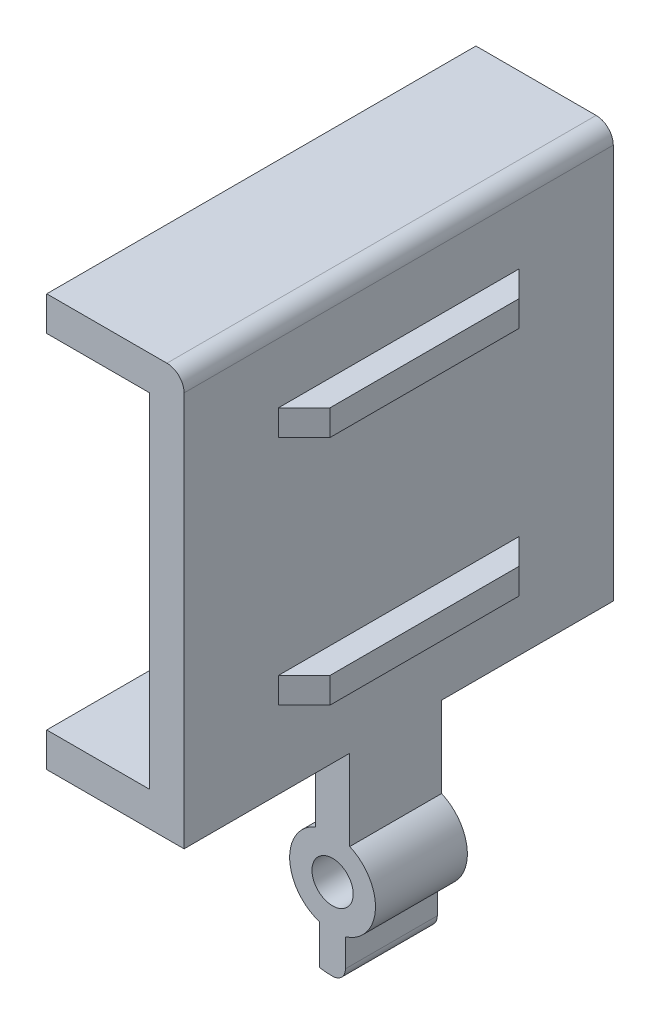
from build123d import *
from build123d.topology import SkipClean

# Parameters (mm, degrees)
LEVER_R                       = 1
BOSS_EXTRUDE1_DEPTH           = 5.35
SKETCH1_R                     = 1.2
CUT_EXTRUDE1_DEPTH            = 32.557448
UPPERJAW_DEPTH                = 5.35
SKETCH5_W                     = 6
SKETCH5_H                     = 2
LOWERJAW_DEPTH                = 5.35
BANDCAPTURE_DEPTH             = 5
BANDCAPTURE_DEPTH_BACK        = 10
SKETCH6_W                     = 1.5
SKETCH6_H                     = 15
CUT_EXTRUDE3_DEPTH            = 34.316662
CUT_EXTRUDE3_DEPTH_BACK       = 34.316662
SKETCH7_W                     = 1.5
SKETCH7_H                     = 12
BATTERYCRADLEWIDTH_DEPTH      = 10
BATTERYCRADLEWIDTH_DEPTH_BACK = 15
CHAMFER1_SIZE                 = 2


with BuildPart() as part:
    # lever → Boss-Extrude1 (new body)
    with BuildSketch(Plane.XY):
        with BuildLine():
            Line((-0.75, -4.690416), (-0.75, -2.384848))
            ThreePointArc((-0.75, -2.384848), (-2.496435, -0.133467), (-1, 2.291288))
            Line((-1, 2.291288), (-1, 30))
            ThreePointArc((-1, 30), (0, 31), (1, 30))
            Line((1, 30), (1, 2.291288))
            ThreePointArc((1, 2.291288), (2.496435, -0.133467), (0.75, -2.384848))
            Line((0.75, -2.384848), (0.75, -4))
            ThreePointArc((0.75, -4), (0.53033, -4.53033), (0, -4.75))
            ThreePointArc((0, -4.75), (-0.376182, -4.735081), (-0.75, -4.690416))
        make_face()
        Circle(LEVER_R, mode=Mode.SUBTRACT)
    extrude(amount=BOSS_EXTRUDE1_DEPTH)

    # Sketch1 → Cut-Extrude1 (cut, through all)
    with BuildSketch(Plane.XY.offset(5.35)):
        Circle(SKETCH1_R)
    extrude(amount=-CUT_EXTRUDE1_DEPTH, mode=Mode.SUBTRACT)

    # Sketch4 → UpperJaw (add)
    with BuildSketch(Plane(origin=(0, 0, 0), x_dir=(-1, 0, 0), z_dir=(0, 0, -1))):
        with BuildLine():
            Line((0, 31), (7, 31))
            Line((7, 31), (7, 29))
            Line((7, 29), (1, 29))
            Line((1, 29), (1, 30))
            ThreePointArc((1, 30), (0.707107, 30.707107), (0, 31))
        make_face()
    extrude(amount=-UPPERJAW_DEPTH)

    # Sketch5 → LowerJaw (add, through all)
    with BuildSketch(Plane(origin=(0, 0, 0), x_dir=(-1, 0, 0), z_dir=(0, 0, -1))):
        with Locations((4, 8)):
            Rectangle(SKETCH5_W, SKETCH5_H)
    extrude(amount=-LOWERJAW_DEPTH)

    # Sketch6 → BandCapture (add, two sides: drawn at the far end of the back side and taken through both)
    with BuildSketch(Plane(origin=(0, 0, 0), x_dir=(-1, 0, 0), z_dir=(0, 0, -1)).offset(-BANDCAPTURE_DEPTH_BACK)):
        with Locations((-1.75, 19)):
            Rectangle(SKETCH6_W, SKETCH6_H)
    extrude(amount=BANDCAPTURE_DEPTH + BANDCAPTURE_DEPTH_BACK)

    # Sketch7 → Cut-Extrude3 (cut, two sides: drawn at the far end of the back side and taken through both)
    with BuildSketch(Plane(origin=(0, 0, 0), x_dir=(-1, 0, 0), z_dir=(0, 0, -1)).offset(-CUT_EXTRUDE3_DEPTH_BACK)):
        with Locations((-1.75, 19)):
            Rectangle(SKETCH7_W, SKETCH7_H)
    extrude(amount=CUT_EXTRUDE3_DEPTH + CUT_EXTRUDE3_DEPTH_BACK, mode=Mode.SUBTRACT)

    # Sketch8 → BatteryCradleWidth (add, two sides: drawn at the far end of the back side and taken through both)
    with SkipClean():  # the faces are left unmerged after this step: merging them gives an invalid solid
        with BuildSketch(Plane(origin=(0, 0, 0), x_dir=(-1, 0, 0), z_dir=(0, 0, -1)).offset(-BATTERYCRADLEWIDTH_DEPTH_BACK)):
            with BuildLine():
                Line((-1, 7), (7, 7))
                Line((7, 7), (7, 9))
                Line((7, 9), (1, 9))
                Line((1, 9), (1, 29))
                Line((1, 29), (7, 29))
                Line((7, 29), (7, 31))
                Line((7, 31), (0, 31))
                ThreePointArc((0, 31), (-0.707107, 30.707107), (-1, 30))
                Line((-1, 30), (-1, 7))
            make_face()
        extrude(amount=BATTERYCRADLEWIDTH_DEPTH + BATTERYCRADLEWIDTH_DEPTH_BACK)

    # Chamfer1
    # the kernel refuses this chamfer: 2 mm, written as the material it takes off along each edge
    with BuildSketch(Plane(origin=(2.5, 19.856634, 10), x_dir=(-0.9996219169112968, 0, 0.027495876610586487), z_dir=(0, 1, 0))) as chamfer1_piece_1_section:
        Polygon((CHAMFER1_SIZE * 0.999621916911, -CHAMFER1_SIZE * 0.0274958766106), (-CHAMFER1_SIZE * 0.0274958766106, -CHAMFER1_SIZE * 0.999621916911), (0, 0), align=None)
    chamfer1_piece_1 = extrude(amount=11.786732, mode=Mode.PRIVATE)
    chamfer1_piece_1 = split(chamfer1_piece_1, bisect_by=Plane(origin=(1, 25.75, 9.296082), z_dir=(1, 0, 0)), keep=Keep.TOP, mode=Mode.PRIVATE)
    add(chamfer1_piece_1, mode=Mode.SUBTRACT)
    with BuildSketch(Plane(origin=(2.5, 6.356634, 10), x_dir=(-0.9996219169112968, 0, 0.027495876610586487), z_dir=(0, 1, 0))) as chamfer1_piece_2_section:
        Polygon((CHAMFER1_SIZE * 0.999621916911, -CHAMFER1_SIZE * 0.0274958766106), (-CHAMFER1_SIZE * 0.0274958766106, -CHAMFER1_SIZE * 0.999621916911), (0, 0), align=None)
    chamfer1_piece_2 = extrude(amount=11.786732, mode=Mode.PRIVATE)
    chamfer1_piece_2 = split(chamfer1_piece_2, bisect_by=Plane(origin=(1, 12.25, 9.296082), z_dir=(1, 0, 0)), keep=Keep.TOP, mode=Mode.PRIVATE)
    add(chamfer1_piece_2, mode=Mode.SUBTRACT)
    with BuildSketch(Plane(origin=(2.5, 6.356634, -5), x_dir=(-0.9996219169112968, 0, -0.027495876610586487), z_dir=(0, 1, 0))) as chamfer1_piece_3_section:
        Polygon((CHAMFER1_SIZE * 0.999621916911, CHAMFER1_SIZE * 0.0274958766106), (-CHAMFER1_SIZE * 0.0274958766106, CHAMFER1_SIZE * 0.999621916911), (0, 0), align=None)
    chamfer1_piece_3 = extrude(amount=11.786732, mode=Mode.PRIVATE)
    chamfer1_piece_3 = split(chamfer1_piece_3, bisect_by=Plane(origin=(1, 12.25, -4.296082), z_dir=(1, 0, 0)), keep=Keep.TOP, mode=Mode.PRIVATE)
    add(chamfer1_piece_3, mode=Mode.SUBTRACT)
    with BuildSketch(Plane(origin=(2.5, 19.856634, -5), x_dir=(-0.9996219169112968, 0, -0.027495876610586487), z_dir=(0, 1, 0))) as chamfer1_piece_4_section:
        Polygon((CHAMFER1_SIZE * 0.999621916911, CHAMFER1_SIZE * 0.0274958766106), (-CHAMFER1_SIZE * 0.0274958766106, CHAMFER1_SIZE * 0.999621916911), (0, 0), align=None)
    chamfer1_piece_4 = extrude(amount=11.786732, mode=Mode.PRIVATE)
    chamfer1_piece_4 = split(chamfer1_piece_4, bisect_by=Plane(origin=(1, 25.75, -4.296082), z_dir=(1, 0, 0)), keep=Keep.TOP, mode=Mode.PRIVATE)
    add(chamfer1_piece_4, mode=Mode.SUBTRACT)


solid = part.part
